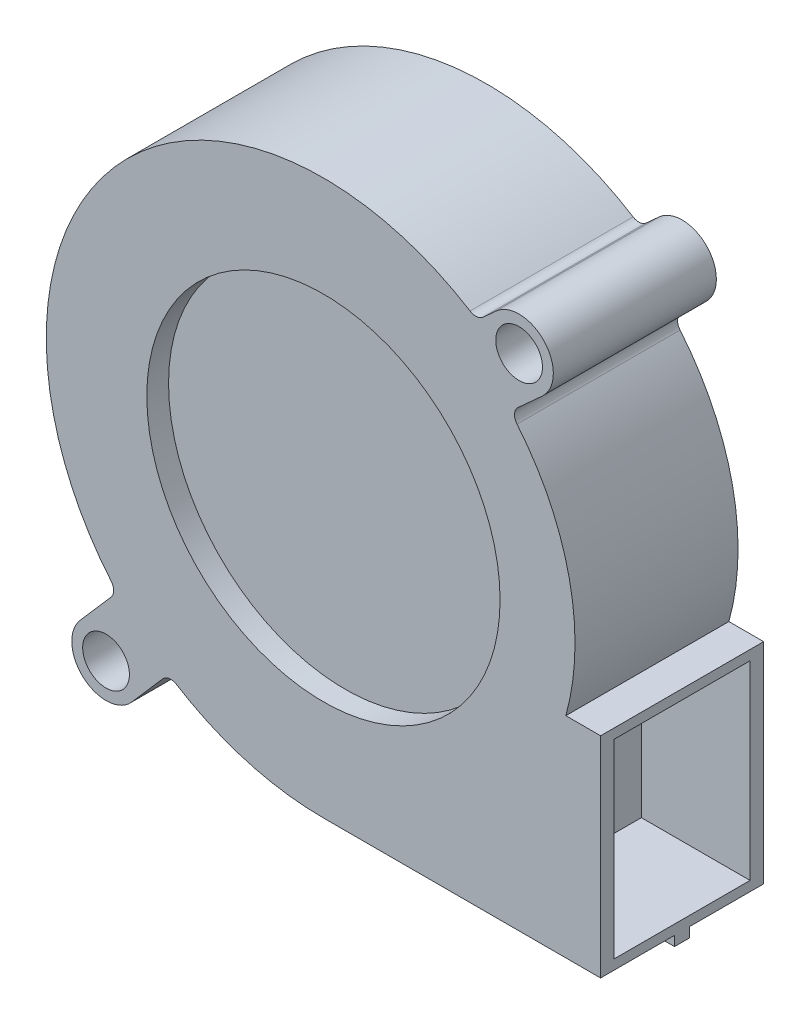
from build123d import *

# Parameters (mm, degrees)
SKETCH1_R           = 2.15
BOSS_EXTRUDE1_DEPTH = 7.5
SKETCH3_W           = 1.4
SKETCH3_H           = 0.9
BOSS_EXTRUDE2_DEPTH = 3
SKETCH4_R           = 16.25
CUT_EXTRUDE1_DEPTH  = 2
SKETCH5_W           = 12.5
SKETCH5_H           = 17.5
CUT_EXTRUDE2_DEPTH  = 10


with BuildPart() as part:
    # Sketch1 → Boss-Extrude1 (new, symmetric)
    with BuildSketch(Plane.XY):
        with BuildLine():
            Line((0, -25.5), (25.5, -25.5))
            Line((25.5, -25.5), (25.5, -6.2))
            Line((25.5, -6.2), (22.3, -6.2))
            ThreePointArc((22.3, -6.2), (22.633696889, 4.842082728), (17.811452389, 14.781142168))
            ThreePointArc((17.811452389, 14.781142168), (17.583444291, 15.489857701), (17.908337826, 16.159715588))
            Line((17.908337826, 16.159715588), (20.118834813, 18.169111965))
            ThreePointArc((20.118834813, 18.169111965), (20.330888035, 22.618834813), (15.881165187, 22.830888035))
            Line((15.881165187, 22.830888035), (14.69074314, 21.748764984))
            ThreePointArc((14.69074314, 21.748764984), (14.108162444, 21.492793575), (13.489112369, 21.64009814))
            ThreePointArc((13.489112369, 21.64009814), (-19.251546311, 16.722080152), (-19.539541583, -16.384636545))
            ThreePointArc((-19.539541583, -16.384636545), (-19.305838355, -17.036142145), (-19.551192594, -17.683350027))
            Line((-19.551192594, -17.683350027), (-22.377007395, -20.933037048))
            ThreePointArc((-22.377007395, -20.933037048), (-22.066962952, -25.377007395), (-17.622992605, -25.066962952))
            Line((-17.622992605, -25.066962952), (-14.797177804, -21.817275931))
            ThreePointArc((-14.797177804, -21.817275931), (-14.190309608, -21.484428012), (-13.512663894, -21.625399753))
            ThreePointArc((-13.512663894, -21.625399753), (-7.028595389, -24.512218318), (0, -25.5))
        make_face()
        with Locations((-20, -23)):
            Circle(SKETCH1_R, mode=Mode.SUBTRACT)
        with Locations((18, 20.5)):
            Circle(SKETCH1_R, mode=Mode.SUBTRACT)
    extrude(amount=BOSS_EXTRUDE1_DEPTH, both=True)

    # Sketch3 → Boss-Extrude2 (add)
    with BuildSketch(Plane(origin=(25.5, 0, 0), x_dir=(0, 0, -1), z_dir=(1, 0, 0))):
        with Locations((0, -25.95)):
            Rectangle(SKETCH3_W, SKETCH3_H)
    extrude(amount=-BOSS_EXTRUDE2_DEPTH)

    # Sketch4 → Cut-Extrude1 (cut)
    with BuildSketch(Plane.XY.offset(7.5)):
        Circle(SKETCH4_R)
    extrude(amount=-CUT_EXTRUDE1_DEPTH, mode=Mode.SUBTRACT)

    # Sketch5 → Cut-Extrude2 (cut)
    with BuildSketch(Plane(origin=(25.5, 0, 0), x_dir=(0, 0, -1), z_dir=(1, 0, 0))):
        with Locations((0, -15.85)):
            Rectangle(SKETCH5_W, SKETCH5_H)
    extrude(amount=-CUT_EXTRUDE2_DEPTH, mode=Mode.SUBTRACT)


solid = part.part
